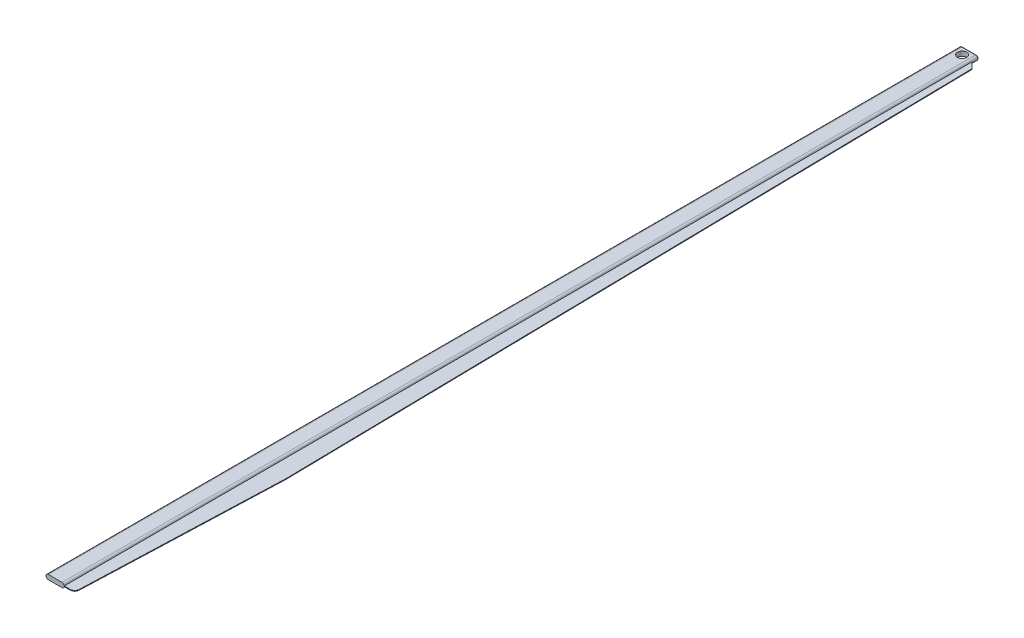
from build123d import *

# Parameters (mm, degrees)
BOSS_EXTRUDE1_DEPTH      = 20
BOSS_EXTRUDE1_DEPTH_BACK = 20
SKETCH4_R                = 250
CUT_EXTRUDE1_DEPTH       = 50023.470204991
FILLET1_R                = 50


with BuildPart() as part:
    # Sweep1: sweep along a path in Sketch2
    with BuildLine(Plane(origin=(0, 0, 0), x_dir=(1, 0, 0), z_dir=(0, 1, 0))) as sweep1_path:
        Line((0, 0), (0, -50000))
    # Sketch1 → Sweep1 (sweep)
    with BuildSketch(Plane.XY):
        with BuildLine():
            Line((-375, 125), (375, 125))
            ThreePointArc((375, 125), (500, 0), (375, -125))
            Line((375, -125), (-375, -125))
            ThreePointArc((-375, -125), (-500, 0), (-375, 125))
        make_face()
    sweep(path=sweep1_path.line)

    # Sketch4 → Cut-Extrude1 (cut, through all)
    with BuildSketch(Plane(origin=(0, 125, 0), x_dir=(1, 0, 0), z_dir=(0, 1, 0))):
        with Locations((0, -400)):
            Circle(SKETCH4_R)
    extrude(amount=-CUT_EXTRUDE1_DEPTH, mode=Mode.SUBTRACT)

    # Fillet1
    fillet1_edges = [part.edges().sort_by_distance(p)[0] for p in [
        (0, 125, 0),
        (500, 0, 0),
        (0, -125, 0),
        (-500, 0, 0),
    ]]
    fillet(fillet1_edges, radius=FILLET1_R)


with BuildPart() as body_2:
    # Sketch3 → Boss-Extrude1 (new, two sides: drawn at the far end of the back side and taken through both)
    with BuildSketch(Plane(origin=(0, 0, 0), x_dir=(1, 0, 0), z_dir=(0, 1, 0)).offset(-BOSS_EXTRUDE1_DEPTH_BACK)):
        with BuildLine():
            Line((500, -366.025403784), (500, -50000))
            Line((500, -50000), (823.341876591, -50000))
            ThreePointArc((823.341876591, -50000), (996.7934932, -49930.040375183), (1073.168229633, -49759.316293567))
            Line((1073.168229633, -49759.316293567), (1474.710205519, -38991.539741161))
            ThreePointArc((1474.710205519, -38991.539741161), (1477.854943998, -38862.501731783), (1477.667761751, -38733.425544176))
            Line((1477.667761751, -38733.425544176), (823.341876591, -689.367280376))
            Line((823.341876591, -689.367280376), (500, -366.025403784))
        make_face()
    extrude(amount=BOSS_EXTRUDE1_DEPTH + BOSS_EXTRUDE1_DEPTH_BACK)


solid = Compound([part.part, body_2.part])
